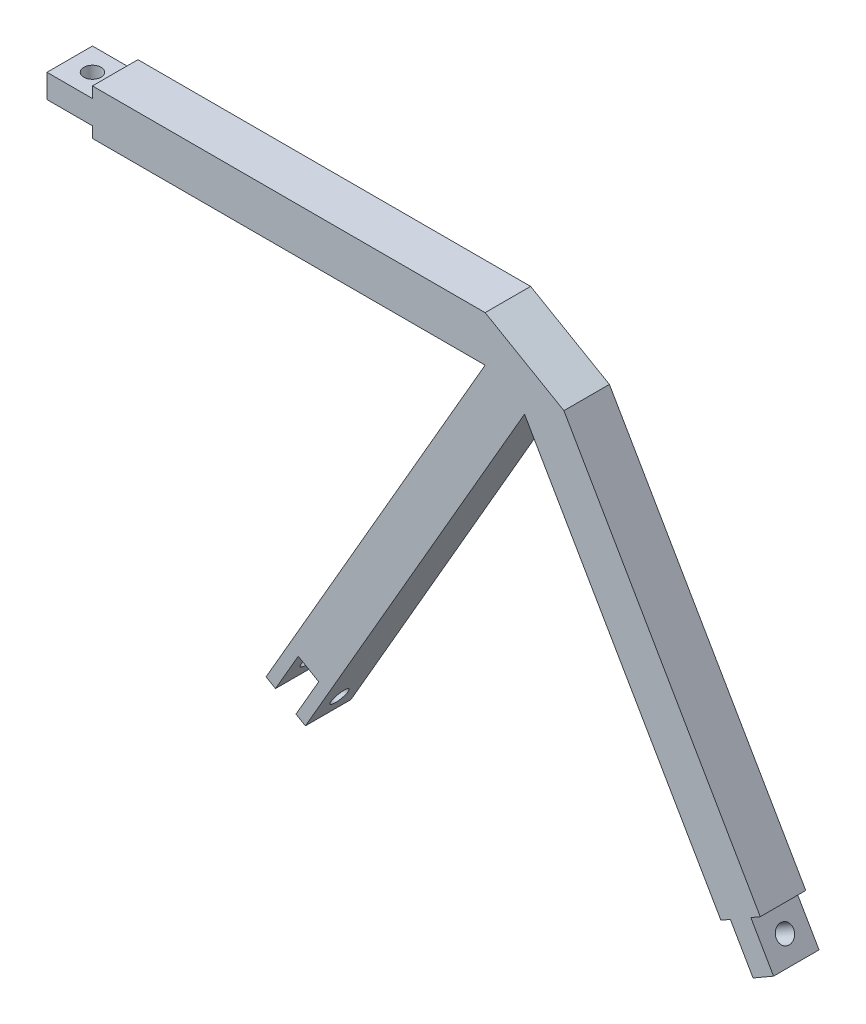
from build123d import *

# Parameters (mm, degrees)
SKETCH1_W               = 5
SKETCH1_H               = 5
SKETCH1_R               = 0.95
CENTER_DEPTH            = 1.3
RIGHTSIDE_START         = 1.3
SKETCH1_2_W             = 5
SKETCH1_2_H             = 5
SKETCH1_2_R             = 0.95
RIGHTSIDE_DEPTH         = 1.2
LEFTSIDE_START          = -1.3
SKETCH1_3_W             = 5
SKETCH1_3_H             = 5
SKETCH1_3_R             = 0.95
LEFTSIDE_DEPTH          = 1.2
SKETCH3_W               = 5
SKETCH3_H               = 5
BOSS_EXTRUDE4_DEPTH     = 47.5
CUT_EXTRUDE1_DEPTH      = 5
CIRPATTERN2_COUNT       = 6
CIRPATTERN3_COUNT       = 3
CIRPATTERN4_START       = -44.601270189
CIRPATTERN4_OUTLINE_W   = 5
CIRPATTERN4_OUTLINE_H   = 5
CIRPATTERN4_OUTLINE_R   = 0.95
CIRPATTERN4_DEPTH       = 2.6
CIRPATTERN4_2_OUTLINE_W = 5
CIRPATTERN4_2_OUTLINE_H = 5
CIRPATTERN4_2_OUTLINE_R = 0.95
CIRPATTERN4_2_DEPTH     = 2.6
CIRPATTERN4_START_2     = -1.3
CIRPATTERN4_3_OUTLINE_W = 5
CIRPATTERN4_3_OUTLINE_H = 5
CIRPATTERN4_3_OUTLINE_R = 0.95
CIRPATTERN4_3_DEPTH     = 2.6
SKETCH5_W               = 5
SKETCH5_H               = 2.6
CUT_EXTRUDE2_DEPTH      = 5


# Read off the part's stored shape, not the designer's step: CirPattern4
with BuildPart() as part:
    # Sketch1 → Center (new, symmetric)
    with BuildSketch(Plane(origin=(0, 0, 0), x_dir=(1, 0, 0), z_dir=(0, 1, 0))):
        Rectangle(SKETCH1_W, SKETCH1_H)
        with Locations(Location((0, 0, 0), (0, 0, 270))):
            Circle(SKETCH1_R, mode=Mode.SUBTRACT)
    extrude(amount=CENTER_DEPTH, both=True)

    # Sketch5 → Cut-Extrude2 (cut)
    with BuildSketch(Plane(origin=(2.5, 0, 0), x_dir=(0, 0, -1), z_dir=(1, 0, 0))):
        Rectangle(SKETCH5_W, SKETCH5_H)
    extrude(amount=-CUT_EXTRUDE2_DEPTH, mode=Mode.SUBTRACT)


with BuildPart() as body_2:
    # Sketch1<2> → RightSide (new body)
    with BuildSketch(Plane(origin=(0, 0, 0), x_dir=(1, 0, 0), z_dir=(0, 1, 0)).offset(RIGHTSIDE_START)):
        Rectangle(SKETCH1_2_W, SKETCH1_2_H)
        with Locations(Location((0, 0, 0), (0, 0, 270))):
            Circle(SKETCH1_2_R, mode=Mode.SUBTRACT)
    extrude(amount=RIGHTSIDE_DEPTH)


with BuildPart() as body_3:
    # Sketch1<3> → LeftSide (new body)
    with BuildSketch(Plane(origin=(0, 0, 0), x_dir=(1, 0, 0), z_dir=(0, 1, 0)).offset(LEFTSIDE_START)):
        Rectangle(SKETCH1_3_W, SKETCH1_3_H)
        with Locations(Location((0, 0, 0), (0, 0, 270))):
            Circle(SKETCH1_3_R, mode=Mode.SUBTRACT)
    extrude(amount=-LEFTSIDE_DEPTH)


with BuildPart() as body_4:
    # Sketch3 → Boss-Extrude4 (new body)
    with BuildSketch(Plane.ZY.offset(2.5)):
        Rectangle(SKETCH3_W, SKETCH3_H)
    extrude(amount=BOSS_EXTRUDE4_DEPTH)

    # Sketch4 → Cut-Extrude1 (cut)
    with BuildSketch(Plane.XY.offset(-2.5)):
        Polygon((-50, 0), (-50, -2.5), (-45.669872981, -2.5), align=None)
        Polygon((-50, 2.5), (-50, 0), (-45.669872981, 2.5), align=None)
    extrude(amount=CUT_EXTRUDE1_DEPTH, mode=Mode.SUBTRACT)


with BuildPart() as cirpattern2_1:
    # CirPattern2: pattern copy
    add(body_4.part.rotate(Axis((-50, 0, 0), (0, 0, 1)), 1 * 360 / CIRPATTERN2_COUNT))


with BuildPart() as cirpattern2_2:
    # CirPattern2: pattern copy
    add(body_4.part.rotate(Axis((-50, 0, 0), (0, 0, 1)), 2 * 360 / CIRPATTERN2_COUNT))


with BuildPart() as cirpattern2_3:
    # CirPattern2: pattern copy
    add(body_4.part.rotate(Axis((-50, 0, 0), (0, 0, 1)), 3 * 360 / CIRPATTERN2_COUNT))


with BuildPart() as cirpattern2_4:
    # CirPattern2: pattern copy
    add(body_4.part.rotate(Axis((-50, 0, 0), (0, 0, 1)), 4 * 360 / CIRPATTERN2_COUNT))


with BuildPart() as cirpattern2_5:
    # CirPattern2: pattern copy
    add(body_4.part.rotate(Axis((-50, 0, 0), (0, 0, 1)), 5 * 360 / CIRPATTERN2_COUNT))


with BuildPart() as cirpattern3_1:
    # CirPattern3: pattern copy
    add(body_3.part.rotate(Axis((-50, 0, 0), (0, 0, 1)), 1 * 360 / CIRPATTERN3_COUNT))


with BuildPart() as cirpattern3_2:
    # CirPattern3: pattern copy
    add(body_3.part.rotate(Axis((-50, 0, 0), (0, 0, 1)), 2 * 360 / CIRPATTERN3_COUNT))


with BuildPart() as cirpattern3_3:
    # CirPattern3: pattern copy
    add(body_2.part.rotate(Axis((-50, 0, 0), (0, 0, 1)), 1 * 360 / CIRPATTERN3_COUNT))


with BuildPart() as cirpattern3_4:
    # CirPattern3: pattern copy
    add(body_2.part.rotate(Axis((-50, 0, 0), (0, 0, 1)), 2 * 360 / CIRPATTERN3_COUNT))


with BuildPart() as body_14:
    # CirPattern4 outline → CirPattern4 (new body)
    with BuildSketch(Plane(origin=(0, 0, 0), x_dir=(0.49999999999999767, 0.86602540378444, 0), z_dir=(0.8660254037844399, -0.49999999999999795, 0)).offset(CIRPATTERN4_START)):
        with Locations((25, 0)):
            Rectangle(CIRPATTERN4_OUTLINE_W, CIRPATTERN4_OUTLINE_H)
        with Locations((25, 0)):
            Circle(CIRPATTERN4_OUTLINE_R, mode=Mode.SUBTRACT)
    extrude(amount=CIRPATTERN4_DEPTH)


with BuildPart() as body_15:
    # CirPattern4 2 outline → CirPattern4 2 (new body)
    with BuildSketch(Plane(origin=(0, 0, 0), x_dir=(0.5000000000000098, -0.8660254037844329, 0), z_dir=(0.8660254037844329, 0.50000000000001, 0)).offset(CIRPATTERN4_START)):
        with Locations((25, 0)):
            Rectangle(CIRPATTERN4_2_OUTLINE_W, CIRPATTERN4_2_OUTLINE_H)
        with Locations((25, 0)):
            Circle(CIRPATTERN4_2_OUTLINE_R, mode=Mode.SUBTRACT)
    extrude(amount=CIRPATTERN4_2_DEPTH)


with BuildPart() as body_16:
    # CirPattern4 3 outline → CirPattern4 3 (new body)
    with BuildSketch(Plane(origin=(0, 0, 0), x_dir=(1, 0, 0), z_dir=(0, 1, 0)).offset(CIRPATTERN4_START_2)):
        with Locations((-100, 0)):
            Rectangle(CIRPATTERN4_3_OUTLINE_W, CIRPATTERN4_3_OUTLINE_H)
        with Locations((-100, 0)):
            Circle(CIRPATTERN4_3_OUTLINE_R, mode=Mode.SUBTRACT)
    extrude(amount=CIRPATTERN4_3_DEPTH)


with BuildPart() as cirpattern2_5_1:
    add(cirpattern2_5.part)

    # Combine1: union CirPattern2_3, CirPattern2_4, body 16, CirPattern3_2, CirPattern3_4, body 15
    add(cirpattern2_3.part)
    add(cirpattern2_4.part)
    add(body_16.part)
    add(cirpattern3_2.part)
    add(cirpattern3_4.part)
    add(body_15.part)

    # Combine3: cut CirPattern3_3, body 14, CirPattern2_1, body 4, body 2, CirPattern2_2, body 3, CirPattern3_1
    add(cirpattern3_3.part, mode=Mode.SUBTRACT)
    add(body_14.part, mode=Mode.SUBTRACT)
    add(cirpattern2_1.part, mode=Mode.SUBTRACT)
    add(body_4.part, mode=Mode.SUBTRACT)
    add(body_2.part, mode=Mode.SUBTRACT)
    add(cirpattern2_2.part, mode=Mode.SUBTRACT)
    add(body_3.part, mode=Mode.SUBTRACT)
    add(cirpattern3_1.part, mode=Mode.SUBTRACT)


solid = cirpattern2_5_1.part
